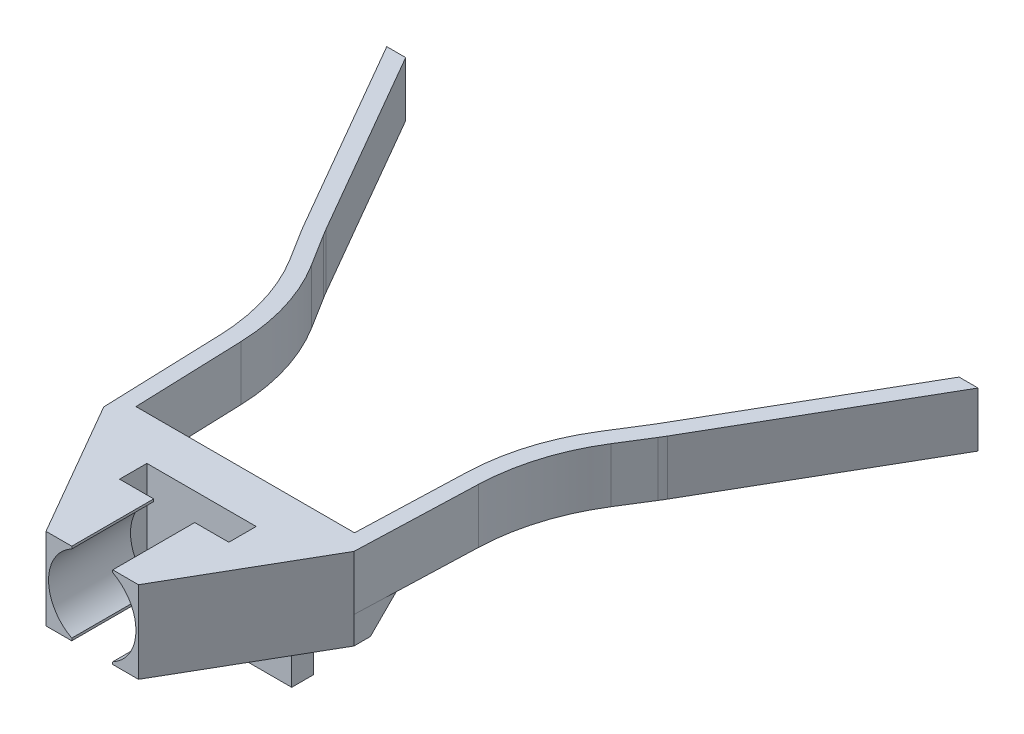
from build123d import *
from OCP.BRepFilletAPI import BRepFilletAPI_MakeChamfer

# Parameters (mm, degrees)
BOSS_EXTRUDE1_DEPTH             = 2
BOSS_EXTRUDE2_REACH             = 41.681
SKETCH2_W                       = 18.31765306
SKETCH2_H                       = 6
BOSS_EXTRUDE2_DIRECTION_2_DEPTH = 10
CUT_EXTRUDE1_DEPTH              = 8
CUT_EXTRUDE2_DEPTH              = 39.837136106
CUT_EXTRUDE2_DEPTH_BACK         = 39.837136106
SKETCH4_W                       = 8
SKETCH4_H                       = 2
CHAMFER1_SIZE                   = 2
CHAMFER2_SIZE                   = 10
CHAMFER2_SIZE2                  = 5.773502692
FILLET1_START                   = -2
FILLET1_DEPTH                   = 4
FILLET1_2_DEPTH                 = 4
BOSS_EXTRUDE3_START             = -6
SKETCH5_W                       = 10
SKETCH5_H                       = 1.6
BOSS_EXTRUDE3_DEPTH             = 10.5


with BuildPart() as part:
    # Sketch1 → Boss-Extrude1 (new, symmetric)
    with BuildSketch(Plane(origin=(0, 0, 0), x_dir=(1, 0, 0), z_dir=(0, 1, 0))):
        Polygon((-8, 0), (0, 0), (0, -1.2), (-9.15882653, -1.2), (-9.606841403, 11.62946737), (-13.196767517, 17.374550089), (-21.640774961, 32), (-20.255134315, 32), (-12.168010072, 17.992689924), (-8.41879396, 11.992689924), align=None)
    boss_extrude1 = extrude(amount=BOSS_EXTRUDE1_DEPTH, both=True)

    # Mirror1: Boss-Extrude1 across plane
    add(boss_extrude1.mirror(Plane(origin=(0, 2, 0), x_dir=(0, 0, 1), z_dir=(-1, 0, 0))))

    # Boss-Extrude2: up to this face of the body (flat: up to its plane)
    boss_extrude2_end = Plane(part.part.faces().sort_by_distance((0, 0, 0))[0])
    # Sketch2 → Boss-Extrude2 (add, up to the picked face)
    with BuildSketch(Plane.XY.offset(1.2), mode=Mode.PRIVATE) as boss_extrude2_sk1:
        with Locations((0, -1)):
            Rectangle(SKETCH2_W, SKETCH2_H)
    boss_extrude2_tool1 = split(extrude(boss_extrude2_sk1.sketch, amount=-BOSS_EXTRUDE2_REACH, mode=Mode.PRIVATE), bisect_by=boss_extrude2_end, keep=Keep.BOTH, mode=Mode.PRIVATE)
    add(boss_extrude2_tool1.solids().sort_by(Axis((0, -1, 1.2), (0, 0, -1)))[0])

    # Sketch2 → Boss-Extrude2 direction 2 (add)
    with BuildSketch(Plane.XY.offset(1.2)):
        with Locations((0, -1)):
            Rectangle(SKETCH2_W, SKETCH2_H)
    extrude(amount=BOSS_EXTRUDE2_DIRECTION_2_DEPTH)

    # Sketch3 → Cut-Extrude1 (cut)
    with BuildSketch(Plane.XY.offset(11.2)):
        with BuildLine():
            Line((-1.5, 1.826658805), (-1.5, 2))
            Line((-1.5, 2), (1.5, 2))
            Line((1.5, 2), (1.5, 1.826658805))
            ThreePointArc((1.5, 1.826658805), (3.2, -1), (1.5, -3.826658805))
            Line((1.5, -3.826658805), (1.5, -4))
            Line((1.5, -4), (-1.5, -4))
            Line((-1.5, -4), (-1.5, -3.826658805))
            ThreePointArc((-1.5, -3.826658805), (-3.2, -1), (-1.5, 1.826658805))
        make_face()
    extrude(amount=-CUT_EXTRUDE1_DEPTH, mode=Mode.SUBTRACT)

    # Sketch4 → Cut-Extrude2 (cut, two sides: drawn at the far end of the back side and taken through both)
    with BuildSketch(Plane(origin=(0, 0, 0), x_dir=(1, 0, 0), z_dir=(0, 1, 0)).offset(-CUT_EXTRUDE2_DEPTH_BACK)):
        with Locations((0, -4.2)):
            Rectangle(SKETCH4_W, SKETCH4_H)
    extrude(amount=CUT_EXTRUDE2_DEPTH + CUT_EXTRUDE2_DEPTH_BACK, mode=Mode.SUBTRACT)

    # Chamfer1
    chamfer1_edges = [part.edges().sort_by_distance(p)[0] for p in [
        (8.579413265, -2, 0),
        (-8.579413265, -2, 0),
    ]]
    chamfer(chamfer1_edges, length=CHAMFER1_SIZE - 0.0001)  # a hair under: the kernel refuses the full size

    # Chamfer2: one chamfer whose edges measure the first distance from different faces: ONE call of the kernel's chamfer builder (chamfer() names one face for all edges)
    chamfer2_edges_1 = [part.edges().sort_by_distance(p)[0] for p in [
        (9.15882653, -1, 11.2),
    ]]
    chamfer2_side_1 = [part.faces().sort_by_distance(p)[0] for p in [
        (9.15882653, -1.126288177, 5.77807488),
    ]]
    chamfer2_edges_2 = [part.edges().sort_by_distance(p)[0] for p in [
        (-9.15882653, -1, 11.2),
    ]]
    chamfer2_side_2 = [part.faces().sort_by_distance(p)[0] for p in [
        (-9.15882653, -1.126288177, 5.77807488),
    ]]
    chamfer2 = BRepFilletAPI_MakeChamfer(part.part.solid().wrapped)
    for e in chamfer2_edges_1:
        chamfer2.Add(CHAMFER2_SIZE, CHAMFER2_SIZE2, e.wrapped, chamfer2_side_1[0].wrapped)  # the first distance lies on this face
    for e in chamfer2_edges_2:
        chamfer2.Add(CHAMFER2_SIZE, CHAMFER2_SIZE2, e.wrapped, chamfer2_side_2[0].wrapped)  # the first distance lies on this face
    add(Compound.cast(chamfer2.Shape()), mode=Mode.REPLACE)

    # Fillet1: read off the stored shape, not the designer's step
    # Fillet1 outline → Fillet1 (cut)
    with BuildSketch(Plane(origin=(0, 0, 0), x_dir=(1, 0, 0), z_dir=(0, 1, 0)).offset(FILLET1_START)):
        with BuildLine():
            Line((13.196767517, 17.374550089), (13.327680504, 17.601298033))
            ThreePointArc((13.327680504, 17.601298033), (13.194808958, 17.37572691), (13.05802089, 17.15250907))
            Line((13.05802089, 17.15250907), (13.196767517, 17.374550089))
        make_face()
        with BuildLine():
            ThreePointArc((8.278524581, 7.975900449), (8.924815647, 11.837983569), (10.548665544, 15.401196962))
            Line((10.548665544, 15.401196962), (8.41879396, 11.992689924))
            Line((8.41879396, 11.992689924), (8.278524581, 7.975900449))
        make_face()
        with BuildLine():
            Line((-13.196767517, 17.374550089), (-13.05802089, 17.15250907))
            ThreePointArc((-13.05802089, 17.15250907), (-13.194808958, 17.37572691), (-13.327680504, 17.601298033))
            Line((-13.327680504, 17.601298033), (-13.196767517, 17.374550089))
        make_face()
        with BuildLine():
            Line((-8.41879396, 11.992689924), (-10.548665544, 15.401196962))
            ThreePointArc((-10.548665544, 15.401196962), (-8.924815647, 11.837983569), (-8.278524581, 7.975900449))
            Line((-8.278524581, 7.975900449), (-8.41879396, 11.992689924))
        make_face()
    extrude(amount=FILLET1_DEPTH, mode=Mode.SUBTRACT)

    # Fillet1 2 outline → Fillet1 2 (add)
    with BuildSketch(Plane(origin=(0, 0, 0), x_dir=(1, 0, 0), z_dir=(0, 1, 0)).offset(FILLET1_START)):
        with BuildLine():
            ThreePointArc((9.466572023, 7.612677895), (10.112863089, 11.474761015), (11.736712986, 15.037974408))
            Line((11.736712986, 15.037974408), (9.606841403, 11.62946737))
            Line((9.606841403, 11.62946737), (9.466572023, 7.612677895))
        make_face()
        with BuildLine():
            ThreePointArc((12.298923059, 18.219437869), (12.166051513, 17.993866745), (12.029263444, 17.770648906))
            Line((12.029263444, 17.770648906), (12.168010072, 17.992689924))
            Line((12.168010072, 17.992689924), (12.298923059, 18.219437869))
        make_face()
        with BuildLine():
            Line((-9.606841403, 11.62946737), (-11.736712986, 15.037974408))
            ThreePointArc((-11.736712986, 15.037974408), (-10.112863089, 11.474761015), (-9.466572023, 7.612677895))
            Line((-9.466572023, 7.612677895), (-9.606841403, 11.62946737))
        make_face()
        with BuildLine():
            ThreePointArc((-12.029263444, 17.770648906), (-12.166051513, 17.993866745), (-12.298923059, 18.219437869))
            Line((-12.298923059, 18.219437869), (-12.168010072, 17.992689924))
            Line((-12.168010072, 17.992689924), (-12.029263444, 17.770648906))
        make_face()
    extrude(amount=FILLET1_2_DEPTH)

    # Sketch5 → Boss-Extrude3 (add)
    with BuildSketch(Plane.XZ.offset(4).offset(BOSS_EXTRUDE3_START)):
        with Locations((0, 0.8)):
            Rectangle(SKETCH5_W, SKETCH5_H)
    extrude(amount=BOSS_EXTRUDE3_DEPTH)


solid = part.part
